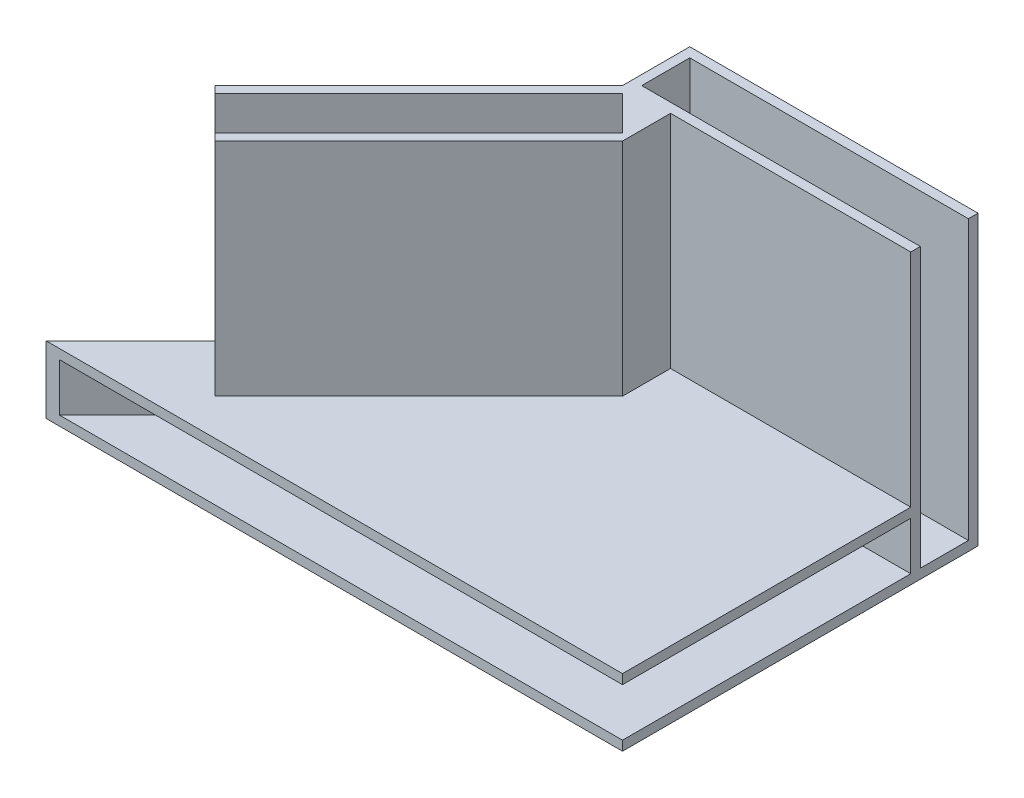
from build123d import *

# Parameters (mm, degrees)
SKETCH1_W           = 30
SKETCH1_H           = 30
BOSS_EXTRUDE1_DEPTH = 7
SHELL1_T            = -1
SKETCH2_W           = 30
SKETCH2_H           = 7
BOSS_EXTRUDE2_DEPTH = 30
SKETCH3_W           = 30
SKETCH3_H           = 7
BOSS_EXTRUDE3_DEPTH = 30
SKETCH5_W           = 5
SKETCH5_H           = 23
BOSS_EXTRUDE4_DEPTH = 5
CUT_EXTRUDE6_DEPTH  = 23
SKETCH12_W          = 7.071067812
SKETCH12_H          = 23
BOSS_EXTRUDE6_DEPTH = 30
CUT_EXTRUDE7_DEPTH  = 22
CUT_EXTRUDE8_DEPTH  = 22
SHELL2_START        = 24
SHELL2_DEPTH        = 5
SHELL2_START_2      = 23
SHELL2_2_DEPTH      = 1
SHELL2_START_3      = 1
SHELL2_3_DEPTH      = 22
BOSS_EXTRUDE7_DEPTH = 1
BOSS_EXTRUDE8_DEPTH = 23
CUT_EXTRUDE10_DEPTH = 1
CUT_EXTRUDE12_START = -30
CUT_EXTRUDE12_DEPTH = 50


# Read off the part's stored shape, not the designer's step: Shell2
with BuildPart() as part:
    # Sketch1 → Boss-Extrude1 (new body)
    with BuildSketch(Plane.XY):
        with Locations((15, 15)):
            Rectangle(SKETCH1_W, SKETCH1_H)
    extrude(amount=BOSS_EXTRUDE1_DEPTH)

    # Shell1
    shell1_openings = [part.faces().sort_by_distance(p)[0] for p in [
        (30, 15, 3.5),
        (15, 0, 3.5),
    ]]
    offset(amount=SHELL1_T, openings=shell1_openings, kind=Kind.INTERSECTION)

    # Sketch2 → Boss-Extrude2 (add)
    with BuildSketch(Plane.XY.offset(7)):
        with Locations((15, 26.5)):
            Rectangle(SKETCH2_W, SKETCH2_H)
    extrude(amount=BOSS_EXTRUDE2_DEPTH)

    # Sketch3 → Boss-Extrude3 (add)
    with BuildSketch(Plane.ZY):
        with Locations((22, 26.5)):
            Rectangle(SKETCH3_W, SKETCH3_H)
    extrude(amount=BOSS_EXTRUDE3_DEPTH)

    # Sketch5 → Boss-Extrude4 (add)
    with BuildSketch(Plane.XY.offset(7)):
        with Locations((2.5, 11.5)):
            Rectangle(SKETCH5_W, SKETCH5_H)
    extrude(amount=BOSS_EXTRUDE4_DEPTH)

    # Sketch6 → Cut-Extrude6 (cut)
    with BuildSketch(Plane.XZ):
        Polygon((0, 12), (5, 12), (0, 7), align=None)
    extrude(amount=-CUT_EXTRUDE6_DEPTH, mode=Mode.SUBTRACT)

    # Sketch12 → Boss-Extrude6 (add)
    with BuildSketch(Plane(origin=(-3.5, 0, 3.5), x_dir=(0.7071067811865475, 0, 0.7071067811865477), z_dir=(-0.7071067811865477, 0, 0.7071067811865475))):
        with Locations((8.485281374, 11.5)):
            Rectangle(SKETCH12_W, SKETCH12_H)
    extrude(amount=BOSS_EXTRUDE6_DEPTH)

    # Sketch13 → Cut-Extrude7 (cut)
    with BuildSketch(Plane.XZ):
        Polygon((-19.798989873, 28.213203436), (0.707106781, 7.707106781), (4.292893219, 11.292893219), (-16.213203436, 31.798989873), (-16.920310217, 32.506096654), (-20.506096654, 28.920310217), align=None)
    extrude(amount=-CUT_EXTRUDE7_DEPTH, mode=Mode.SUBTRACT)

    # Sketch4 → Cut-Extrude8 (cut)
    with BuildSketch(Plane.XZ.offset(-23)):
        Polygon((-30, 37), (0, 7), (-30, 7), align=None)
    extrude(amount=-CUT_EXTRUDE8_DEPTH, mode=Mode.SUBTRACT)

    # Shell2 outline → Shell2 (cut)
    with BuildSketch(Plane(origin=(0, 0, 0), x_dir=(1, 0, 0), z_dir=(0, 1, 0)).offset(SHELL2_START)):
        Polygon((29, -37), (29, -7), (1, -7), (1, -7.414213562), (-28.585786438, -37), align=None)
    extrude(amount=SHELL2_DEPTH, mode=Mode.SUBTRACT)

    # Shell2 2 outline → Shell2 2 (cut)
    with BuildSketch(Plane(origin=(0, 0, 0), x_dir=(1, 0, 0), z_dir=(0, 1, 0)).offset(SHELL2_START_2)):
        Polygon((4, -7), (1, -7), (1, -7.414213562), (-19.798989873, -28.213203435), (-16.213203436, -31.798989873), (4, -11.585786438), align=None)
    extrude(amount=SHELL2_2_DEPTH, mode=Mode.SUBTRACT)

    # Shell2 3 outline → Shell2 3 (cut)
    with BuildSketch(Plane(origin=(0, 0, 0), x_dir=(1, 0, 0), z_dir=(0, 1, 0)).offset(SHELL2_START_3)):
        Polygon((4, -9.585786438), (4, -7), (1.414213562, -7), align=None)
    extrude(amount=SHELL2_3_DEPTH, mode=Mode.SUBTRACT)

    # Sketch16 → Boss-Extrude7 (add)
    with BuildSketch(Plane(origin=(0, 23, 0), x_dir=(1, 0, 0), z_dir=(0, 1, 0))):
        Polygon((1.414213562, -7), (1, -7), (1, -7.414213562), (-19.798989873, -28.213203436), (-16.213203436, -31.798989873), (4, -11.585786438), (4, -9.585786438), align=None)
    extrude(amount=BOSS_EXTRUDE7_DEPTH)

    # Sketch18 → Boss-Extrude8 (add)
    with BuildSketch(Plane(origin=(0, 1, 0), x_dir=(1, 0, 0), z_dir=(0, 1, 0))):
        Polygon((4, -9.585786438), (4, -7), (1.414213562, -7), align=None)
    extrude(amount=BOSS_EXTRUDE8_DEPTH)

    # Sketch19 → Cut-Extrude10 (cut)
    with BuildSketch(Plane(origin=(30, 0, 0), x_dir=(0, 0, -1), z_dir=(1, 0, 0))):
        Polygon((-36, 29), (-37, 29), (-37, 24), (-36, 24), (-7, 24), (-7, 29), align=None)
    extrude(amount=-CUT_EXTRUDE10_DEPTH, mode=Mode.SUBTRACT)

    # Mirror4: part across plane


with BuildPart() as part_1:
    add(part.part)
    add(part.part.mirror(Plane(origin=(0, 0, 7), x_dir=(0, 0, 1), z_dir=(0, 1, 0))))

    # Sketch20 → Cut-Extrude12 (cut)
    with BuildSketch(Plane.XZ.offset(30).offset(CUT_EXTRUDE12_START)):
        Polygon((0, 7), (0, 0), (30, 0), (30, 37), (-30, 37), align=None)
    extrude(amount=-CUT_EXTRUDE12_DEPTH, mode=Mode.SUBTRACT)


solid = part_1.part
